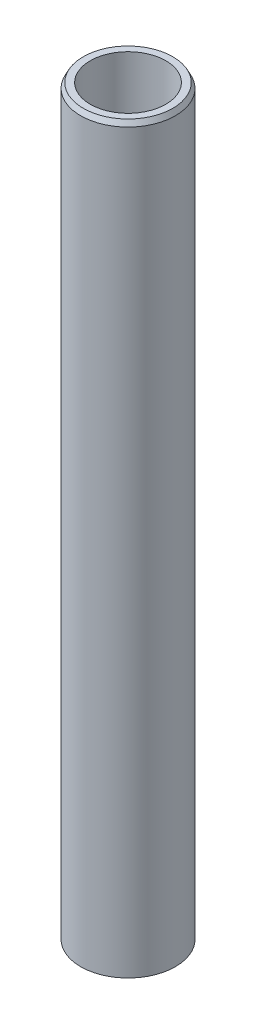
from build123d import *
from OCP.BRepFilletAPI import BRepFilletAPI_MakeChamfer

# Parameters (mm, degrees)
SKETCH1_R           = 30
BOSS_EXTRUDE1_DEPTH = 471.571712043
SKETCH2_R           = 23.917097701
CUT_EXTRUDE1_DEPTH  = 474.476377023
CHAMFER1_SIZE       = 3.237042177
CHAMFER1_SIZE2      = 1.661097143


with BuildPart() as part:
    # Sketch1 → Boss-Extrude1 (new body)
    with BuildSketch(Plane(origin=(0, 0, 0), x_dir=(1, 0, 0), z_dir=(0, 1, 0))):
        Circle(SKETCH1_R)
    extrude(amount=BOSS_EXTRUDE1_DEPTH)

    # Sketch2 → Cut-Extrude1 (cut, through all)
    with BuildSketch(Plane(origin=(0, 0, 0), x_dir=(1, 0, 0), z_dir=(0, 1, 0))):
        Circle(SKETCH2_R)
    extrude(amount=CUT_EXTRUDE1_DEPTH, mode=Mode.SUBTRACT)

    # Chamfer1: one chamfer whose edges measure the first distance from different faces: ONE call of the kernel's chamfer builder (chamfer() names one face for all edges)
    chamfer1_edges_1 = [part.edges().sort_by_distance(p)[0] for p in [
        (-30, 471.571712043, 0),
    ]]
    chamfer1_side_1 = [part.faces().sort_by_distance(p)[0] for p in [
        (-30, 235.785856021, 0),
    ]]
    chamfer1_edges_2 = [part.edges().sort_by_distance(p)[0] for p in [
        (-30, 0, 0),
    ]]
    chamfer1_side_2 = [part.faces().sort_by_distance(p)[0] for p in [
        (-29.151471863, 0, 0),
    ]]
    chamfer1 = BRepFilletAPI_MakeChamfer(part.part.solid().wrapped)
    for e in chamfer1_edges_1:
        chamfer1.Add(CHAMFER1_SIZE, CHAMFER1_SIZE2, e.wrapped, chamfer1_side_1[0].wrapped)  # the first distance lies on this face
    for e in chamfer1_edges_2:
        chamfer1.Add(CHAMFER1_SIZE, CHAMFER1_SIZE2, e.wrapped, chamfer1_side_2[0].wrapped)  # the first distance lies on this face
    add(Compound.cast(chamfer1.Shape()), mode=Mode.REPLACE)


solid = part.part
